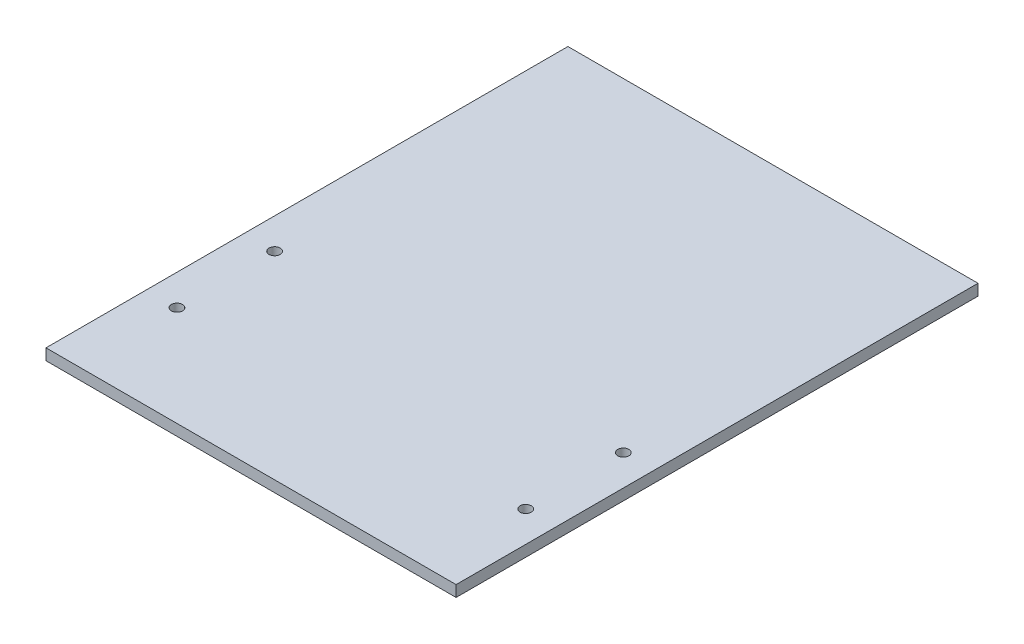
from build123d import *

# Parameters (mm, degrees)
SKETCH1_W           = 110
SKETCH1_H           = 140
BOSS_EXTRUDE1_DEPTH = 3
SKETCH2_R           = 1.5
CUT_EXTRUDE1_DEPTH  = 90.073003767


with BuildPart() as part:
    # Sketch1 → Boss-Extrude1 (new body)
    with BuildSketch(Plane(origin=(0, 0, 0), x_dir=(1, 0, 0), z_dir=(0, 1, 0))):
        Rectangle(SKETCH1_W, SKETCH1_H)
    extrude(amount=BOSS_EXTRUDE1_DEPTH)

    # Sketch2 → Cut-Extrude1 (cut, through all)
    with BuildSketch(Plane(origin=(0, 3, 0), x_dir=(1, 0, 0), z_dir=(0, 1, 0))):
        with Locations((-46.770246749, -16.9)):
            Circle(SKETCH2_R)
        with Locations((-46.770246749, -43.1)):
            Circle(SKETCH2_R)
        with Locations((46.770246749, -43.1)):
            Circle(SKETCH2_R)
        with Locations((46.770246749, -16.9)):
            Circle(SKETCH2_R)
    extrude(amount=-CUT_EXTRUDE1_DEPTH, mode=Mode.SUBTRACT)


solid = part.part
